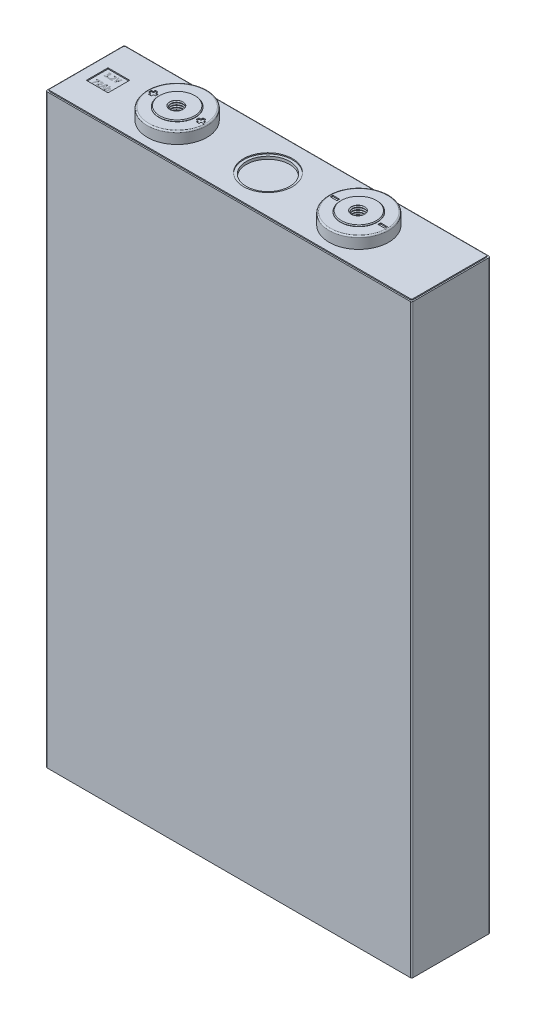
from build123d import *

# Parameters (mm, degrees)
SKETCH1_W           = 135
SKETCH1_H           = 29
BOSS_EXTRUDE1_DEPTH = 216
SKETCH2_W           = 134
SKETCH2_H           = 28
BOSS_EXTRUDE2_DEPTH = 0.4
SKETCH3_R           = 9
CUT_EXTRUDE1_DEPTH  = 0.4
SKETCH4_R           = 8
CUT_EXTRUDE2_DEPTH  = 1
SKETCH6_R           = 11
BOSS_EXTRUDE4_DEPTH = 4.25
SKETCH7_R           = 6.75
BOSS_EXTRUDE5_DEPTH = 0.4
SKETCH8_R           = 2.25
CUT_EXTRUDE3_DEPTH  = 8
THREAD1_PITCH       = 0.8
THREAD2_PITCH       = 0.8
CHAMFER1_SIZE       = 0.3
FILLET1_R           = 0.5
FILLET2_R           = 0.5
FILLET3_R           = 0.5
CUT_EXTRUDE4_DEPTH  = 0.4
CUT_EXTRUDE5_DEPTH  = 0.4
BOSS_EXTRUDE6_DEPTH = 0.01
SCALE2_SCALE        = 0.6


with BuildPart() as part:
    # Sketch1 → Boss-Extrude1 (new body)
    with BuildSketch(Plane(origin=(0, 0, 0), x_dir=(1, 0, 0), z_dir=(0, 1, 0))):
        Rectangle(SKETCH1_W, SKETCH1_H)
    extrude(amount=BOSS_EXTRUDE1_DEPTH)

    # Sketch2 → Boss-Extrude2 (add)
    with BuildSketch(Plane(origin=(0, 0, 0), x_dir=(-1, 0, 0), z_dir=(0, -1, 0))):
        Rectangle(SKETCH2_W, SKETCH2_H)
    boss_extrude2 = extrude(amount=BOSS_EXTRUDE2_DEPTH)

    # Mirror1: Boss-Extrude2 across plane
    add(boss_extrude2.mirror(Plane.ZX.offset(108)))

    # Sketch3 → Cut-Extrude1 (cut)
    with BuildSketch(Plane(origin=(0, 216.4, 0), x_dir=(1, 0, 0), z_dir=(0, 1, 0))):
        with Locations(Location((0, 0, 0), (0, 0, 270))):
            Circle(SKETCH3_R)
    extrude(amount=-CUT_EXTRUDE1_DEPTH, mode=Mode.SUBTRACT)

    # Sketch4 → Cut-Extrude2 (cut)
    with BuildSketch(Plane(origin=(0, 216, 0), x_dir=(1, 0, 0), z_dir=(0, 1, 0))):
        with Locations(Location((0, 0, 0), (0, 0, 270))):
            Circle(SKETCH4_R)
    extrude(amount=-CUT_EXTRUDE2_DEPTH, mode=Mode.SUBTRACT)

    # Sketch6 → Boss-Extrude4 (add)
    with BuildSketch(Plane(origin=(0, 216.4, 0), x_dir=(1, 0, 0), z_dir=(0, 1, 0))):
        with Locations(Location((-33.5, 0, 0), (0, 0, 90))):
            Circle(SKETCH6_R)
        with Locations(Location((33.5, 0, 0), (0, 0, 90))):
            Circle(SKETCH6_R)
    extrude(amount=BOSS_EXTRUDE4_DEPTH)

    # Sketch7 → Boss-Extrude5 (add)
    with BuildSketch(Plane(origin=(0, 220.65, 0), x_dir=(1, 0, 0), z_dir=(0, 1, 0))):
        with Locations(Location((-33.5, 0, 0), (0, 0, 270))):
            Circle(SKETCH7_R)
        with Locations(Location((33.5, 0, 0), (0, 0, 270))):
            Circle(SKETCH7_R)
    extrude(amount=BOSS_EXTRUDE5_DEPTH)

    # Sketch8 → Cut-Extrude3 (cut)
    with BuildSketch(Plane(origin=(0, 221.05, 0), x_dir=(1, 0, 0), z_dir=(0, 1, 0))):
        with Locations(Location((33.5, 0, 0), (0, 0, 270))):
            Circle(SKETCH8_R)
        with Locations(Location((-33.5, 0, 0), (0, 0, 270))):
            Circle(SKETCH8_R)
    extrude(amount=-CUT_EXTRUDE3_DEPTH, mode=Mode.SUBTRACT)

    # Thread1: arcs per turn and ends read off the stored shape
    # Thread1: the profile of Thread Profile1 profile screwed along a right-hand helix through 10 turns, 8 arcs to a turn; built about Z, then put on its axis
    thread1_z = Axis((0, 0, 0), (0, 0, 1))
    thread1_corners = [(2.2497, 0, -0.000173205), (2.6830127, 0, 0.249999999), (2.6830127, 0, 0.349999999), (2.2497, 0, 0.600173203)]
    with BuildLine(mode=Mode.PRIVATE) as thread1_profile:
        Line(thread1_corners[0], thread1_corners[1])
        Line(thread1_corners[1], thread1_corners[2])
        Line(thread1_corners[2], thread1_corners[3])
        Line(thread1_corners[3], thread1_corners[0])
    thread1_cap = Face(thread1_profile.wire())
    thread1_turn_angles = [0, 22.5, 45, 67.5, 90, 112.5, 135, 157.5, 180, 202.5, 225, 247.5, 270, 292.5, 315, 337.5, 360]
    thread1_turn_weights = [1, 0.9238795325112867, 1, 0.9238795325112867, 1, 0.9238795325112867, 1, 0.9238795325112867, 1, 0.9238795325112867, 1, 0.9238795325112867, 1, 0.9238795325112867, 1, 0.9238795325112867, 1]
    thread1_turn_rails = [Edge.make_bspline([Vector(p[0], p[1], 0).rotate(thread1_z, thread1_turn_angles[k]) / thread1_turn_weights[k] + Vector(0, 0, p[2] + THREAD1_PITCH * thread1_turn_angles[k] / 360) for k in range(17)], [0, 0, 0, 1, 1, 2, 2, 3, 3, 4, 4, 5, 5, 6, 6, 7, 7, 8, 8, 8], 2, thread1_turn_weights) for p in thread1_corners]
    thread1_turn_sides = [Face.make_surface_from_curves(thread1_turn_rails[p[0]], thread1_turn_rails[p[1]]) for p in [(0, 1), (1, 2), (2, 3), (3, 0)]]
    thread1 = Plane(origin=(33.5, 213.05, 0), x_dir=(1, 0, 0), z_dir=(0, 1, 0)) * Solid(Shell([*[p.moved(Location((0, 0, THREAD1_PITCH * i))) for i in range(10) for p in thread1_turn_sides], thread1_cap, thread1_cap.rotate(thread1_z, 3600).moved(Location((0, 0, THREAD1_PITCH * 3600 / 360)))]))
    add(thread1, mode=Mode.SUBTRACT)

    # Thread2: arcs per turn and ends read off the stored shape
    # Thread2: the profile of Thread Profile2 profile screwed along a right-hand helix through 10 turns, 8 arcs to a turn; built about Z, then put on its axis
    thread2_z = Axis((0, 0, 0), (0, 0, 1))
    thread2_corners = [(2.2497, 0, -0.000173205), (2.6830127, 0, 0.249999999), (2.6830127, 0, 0.349999999), (2.2497, 0, 0.600173203)]
    with BuildLine(mode=Mode.PRIVATE) as thread2_profile:
        Line(thread2_corners[0], thread2_corners[1])
        Line(thread2_corners[1], thread2_corners[2])
        Line(thread2_corners[2], thread2_corners[3])
        Line(thread2_corners[3], thread2_corners[0])
    thread2_cap = Face(thread2_profile.wire())
    thread2_turn_angles = [0, 22.5, 45, 67.5, 90, 112.5, 135, 157.5, 180, 202.5, 225, 247.5, 270, 292.5, 315, 337.5, 360]
    thread2_turn_weights = [1, 0.9238795325112867, 1, 0.9238795325112867, 1, 0.9238795325112867, 1, 0.9238795325112867, 1, 0.9238795325112867, 1, 0.9238795325112867, 1, 0.9238795325112867, 1, 0.9238795325112867, 1]
    thread2_turn_rails = [Edge.make_bspline([Vector(p[0], p[1], 0).rotate(thread2_z, thread2_turn_angles[k]) / thread2_turn_weights[k] + Vector(0, 0, p[2] + THREAD2_PITCH * thread2_turn_angles[k] / 360) for k in range(17)], [0, 0, 0, 1, 1, 2, 2, 3, 3, 4, 4, 5, 5, 6, 6, 7, 7, 8, 8, 8], 2, thread2_turn_weights) for p in thread2_corners]
    thread2_turn_sides = [Face.make_surface_from_curves(thread2_turn_rails[p[0]], thread2_turn_rails[p[1]]) for p in [(0, 1), (1, 2), (2, 3), (3, 0)]]
    thread2 = Plane(origin=(-33.5, 213.05, 0), x_dir=(1, 0, 0), z_dir=(0, 1, 0)) * Solid(Shell([*[p.moved(Location((0, 0, THREAD2_PITCH * i))) for i in range(10) for p in thread2_turn_sides], thread2_cap, thread2_cap.rotate(thread2_z, 3600).moved(Location((0, 0, THREAD2_PITCH * 3600 / 360)))]))
    add(thread2, mode=Mode.SUBTRACT)

    # Chamfer1
    chamfer1_edges = [part.edges().sort_by_distance(p)[0] for p in [
        (-33.5, 221.05, -6.75),
        (33.5, 221.05, -6.75),
    ]]
    chamfer(chamfer1_edges, length=CHAMFER1_SIZE)

    # Fillet1
    fillet1_edges = [part.edges().sort_by_distance(p)[0] for p in [
        (-33.5, 220.65, 11),
        (33.5, 220.65, 11),
    ]]
    fillet(fillet1_edges, radius=FILLET1_R)

    # Fillet2
    fillet2_edges = [part.edges().sort_by_distance(p)[0] for p in [
        (67.5, 108, 14.5),
        (-67.5, 108, 14.5),
        (-67.5, 108, -14.5),
        (67.5, 108, -14.5),
    ]]
    fillet(fillet2_edges, radius=FILLET2_R)

    # Fillet3
    fillet3_edges = [part.edges().sort_by_distance(p)[0] for p in [
        (67, -0.2, -14),
        (67, -0.2, 14),
        (-67, -0.2, 14),
        (-67, -0.2, -14),
        (67, 216.2, 14),
        (67, 216.2, -14),
        (-67, 216.2, -14),
        (-67, 216.2, 14),
    ]]
    fillet(fillet3_edges, radius=FILLET3_R)

    # Sketch15 → Cut-Extrude4 (cut)
    with BuildSketch(Plane(origin=(0, 220.65, 0), x_dir=(1, 0, 0), z_dir=(0, 1, 0))):
        with BuildLine():
            Line((43.45, 0.5), (41.15, 0.5))
            ThreePointArc((41.15, 0.5), (41.079289322, 0.470710678), (41.05, 0.4))
            Line((41.05, 0.4), (41.05, -0.4))
            ThreePointArc((41.05, -0.4), (41.079289322, -0.470710678), (41.15, -0.5))
            Line((41.15, -0.5), (43.45, -0.5))
            ThreePointArc((43.45, -0.5), (43.520710678, -0.470710678), (43.55, -0.4))
            Line((43.55, -0.4), (43.55, 0.4))
            ThreePointArc((43.55, 0.4), (43.520710678, 0.470710678), (43.45, 0.5))
        make_face()
        with BuildLine():
            Line((25.95, 0.4), (25.95, -0.4))
            ThreePointArc((25.95, -0.4), (25.920710678, -0.470710678), (25.85, -0.5))
            Line((25.85, -0.5), (23.55, -0.5))
            ThreePointArc((23.55, -0.5), (23.479289322, -0.470710678), (23.45, -0.4))
            Line((23.45, -0.4), (23.45, 0.4))
            ThreePointArc((23.45, 0.4), (23.479289322, 0.470710678), (23.55, 0.5))
            Line((23.55, 0.5), (25.85, 0.5))
            ThreePointArc((25.85, 0.5), (25.920710678, 0.470710678), (25.95, 0.4))
        make_face()
        with BuildLine():
            Line((-41.05, 0.4), (-41.05, -0.4))
            ThreePointArc((-41.05, -0.4), (-41.079289322, -0.470710678), (-41.15, -0.5))
            Line((-41.15, -0.5), (-41.7, -0.5))
            ThreePointArc((-41.7, -0.5), (-41.770710678, -0.529289322), (-41.8, -0.6))
            Line((-41.8, -0.6), (-41.8, -1.15))
            ThreePointArc((-41.8, -1.15), (-41.829289322, -1.220710678), (-41.9, -1.25))
            Line((-41.9, -1.25), (-42.7, -1.25))
            ThreePointArc((-42.7, -1.25), (-42.770710678, -1.220710678), (-42.8, -1.15))
            Line((-42.8, -1.15), (-42.8, -0.6))
            ThreePointArc((-42.8, -0.6), (-42.829289322, -0.529289322), (-42.9, -0.5))
            Line((-42.9, -0.5), (-43.45, -0.5))
            ThreePointArc((-43.45, -0.5), (-43.520710678, -0.470710678), (-43.55, -0.4))
            Line((-43.55, -0.4), (-43.55, 0.4))
            ThreePointArc((-43.55, 0.4), (-43.520710678, 0.470710678), (-43.45, 0.5))
            Line((-43.45, 0.5), (-42.9, 0.5))
            ThreePointArc((-42.9, 0.5), (-42.829289322, 0.529289322), (-42.8, 0.6))
            Line((-42.8, 0.6), (-42.8, 1.15))
            ThreePointArc((-42.8, 1.15), (-42.770710678, 1.220710678), (-42.7, 1.25))
            Line((-42.7, 1.25), (-41.9, 1.25))
            ThreePointArc((-41.9, 1.25), (-41.829289322, 1.220710678), (-41.8, 1.15))
            Line((-41.8, 1.15), (-41.8, 0.6))
            ThreePointArc((-41.8, 0.6), (-41.770710678, 0.529289322), (-41.7, 0.5))
            Line((-41.7, 0.5), (-41.15, 0.5))
            ThreePointArc((-41.15, 0.5), (-41.079289322, 0.470710678), (-41.05, 0.4))
        make_face()
        with BuildLine():
            Line((-24.2, 0.6), (-24.2, 1.15))
            ThreePointArc((-24.2, 1.15), (-24.229289322, 1.220710678), (-24.3, 1.25))
            Line((-24.3, 1.25), (-25.1, 1.25))
            ThreePointArc((-25.1, 1.25), (-25.170710678, 1.220710678), (-25.2, 1.15))
            Line((-25.2, 1.15), (-25.2, 0.6))
            ThreePointArc((-25.2, 0.6), (-25.229289322, 0.529289322), (-25.3, 0.5))
            Line((-25.3, 0.5), (-25.85, 0.5))
            ThreePointArc((-25.85, 0.5), (-25.920710678, 0.470710678), (-25.95, 0.4))
            Line((-25.95, 0.4), (-25.95, -0.4))
            ThreePointArc((-25.95, -0.4), (-25.920710678, -0.470710678), (-25.85, -0.5))
            Line((-25.85, -0.5), (-25.3, -0.5))
            ThreePointArc((-25.3, -0.5), (-25.229289322, -0.529289322), (-25.2, -0.6))
            Line((-25.2, -0.6), (-25.2, -1.15))
            ThreePointArc((-25.2, -1.15), (-25.170710678, -1.220710678), (-25.1, -1.25))
            Line((-25.1, -1.25), (-24.3, -1.25))
            ThreePointArc((-24.3, -1.25), (-24.229289322, -1.220710678), (-24.2, -1.15))
            Line((-24.2, -1.15), (-24.2, -0.6))
            ThreePointArc((-24.2, -0.6), (-24.170710678, -0.529289322), (-24.1, -0.5))
            Line((-24.1, -0.5), (-23.55, -0.5))
            ThreePointArc((-23.55, -0.5), (-23.479289322, -0.470710678), (-23.45, -0.4))
            Line((-23.45, -0.4), (-23.45, 0.4))
            ThreePointArc((-23.45, 0.4), (-23.479289322, 0.470710678), (-23.55, 0.5))
            Line((-23.55, 0.5), (-24.1, 0.5))
            ThreePointArc((-24.1, 0.5), (-24.170710678, 0.529289322), (-24.2, 0.6))
        make_face()
    extrude(amount=-CUT_EXTRUDE4_DEPTH, mode=Mode.SUBTRACT)

    # Sketch16 → Cut-Extrude5 (cut)
    with BuildSketch(Plane(origin=(0, 216.4, 0), x_dir=(1, 0, 0), z_dir=(0, 1, 0))):
        with BuildLine():
            Line((-55.2, 4), (-62.8, 4))
            ThreePointArc((-62.8, 4), (-62.941421356, 3.941421356), (-63, 3.8))
            Line((-63, 3.8), (-63, -3.8))
            ThreePointArc((-63, -3.8), (-62.941421356, -3.941421356), (-62.8, -4))
            Line((-62.8, -4), (-55.2, -4))
            ThreePointArc((-55.2, -4), (-55.058578644, -3.941421356), (-55, -3.8))
            Line((-55, -3.8), (-55, 3.8))
            ThreePointArc((-55, 3.8), (-55.058578644, 3.941421356), (-55.2, 4))
        make_face()
    extrude(amount=-CUT_EXTRUDE5_DEPTH, mode=Mode.SUBTRACT)

    # Sketch17 → Boss-Extrude6 (add)
    # profile 1 of 8: a face of its own
    with BuildSketch(Plane(origin=(0, 216, 0), x_dir=(1, 0, 0), z_dir=(0, 1, 0))):
        with BuildLine():
            add(Edge.make_bspline(
                [(-61.013603983, 2.077031829), (-61.00056812, 2.081953142), (-60.97490373, 2.091641991), (-60.938214824, 2.109123778), (-60.903802204, 2.128600297), (-60.87207919, 2.150682551), (-60.842452145, 2.174471652), (-60.815178632, 2.200464926), (-60.790750304, 2.228971866), (-60.768287837, 2.259056894), (-60.749096504, 2.291178313), (-60.731237456, 2.323962662), (-60.717248289, 2.35853496), (-60.704918295, 2.393783875), (-60.696014876, 2.430456669), (-60.689161883, 2.468081769), (-60.684928813, 2.507029093), (-60.684311898, 2.533383233), (-60.683999778, 2.546716781)],
                knots=[0, 0, 0, 0, 1.087849232, 2.141706252, 3.170578034, 4.17264117, 5.156899428, 6.135856436, 7.110126461, 8.085928397, 9.064097591, 10.030173025, 10.998241396, 11.973005849, 12.94440323, 13.941839655, 14.958699474, 16, 16, 16, 16], degree=3))
            add(Edge.make_bspline(
                [(-60.683999778, 2.546716781), (-60.684310647, 2.5633283), (-60.684920423, 2.595912147), (-60.691238243, 2.643713942), (-60.701005465, 2.689505758), (-60.714378553, 2.733334799), (-60.732358048, 2.774854722), (-60.754378434, 2.814155321), (-60.78005621, 2.851574359), (-60.809468143, 2.886804111), (-60.842963888, 2.919037131), (-60.88097963, 2.946934391), (-60.92289073, 2.971056862), (-60.96914625, 2.990317752), (-61.019015307, 3.006421342), (-61.073166605, 3.017387831), (-61.1311244, 3.025132182), (-61.171278646, 3.026686881), (-61.19191833, 3.027486012)],
                knots=[0, 0, 0, 0, 1.009492297, 1.980140478, 2.925951987, 3.854155462, 4.7612932, 5.671323502, 6.589181822, 7.51678736, 8.457304499, 9.408012391, 10.37676339, 11.390268556, 12.44887027, 13.55801485, 14.744795279, 16, 16, 16, 16], degree=3))
            add(Edge.make_bspline(
                [(-61.19191833, 3.027486012), (-61.215445905, 3.026713624), (-61.261637756, 3.02519719), (-61.329515017, 3.016822513), (-61.394400381, 3.003192755), (-61.455850602, 2.985199884), (-61.512708907, 2.963864924), (-61.563954388, 2.940535088), (-61.609612937, 2.916030065), (-61.63617765, 2.896561682), (-61.648931904, 2.887214519)],
                knots=[0, 0, 0, 0, 1.163088269, 2.283499147, 3.375209201, 4.436807197, 5.445325293, 6.373885885, 7.219269795, 8, 8, 8, 8], degree=3))
            Line((-61.648931904, 2.887214519), (-61.578595837, 2.665943942))
            add(Edge.make_bspline(
                [(-61.578595837, 2.665943942), (-61.569105312, 2.673380057), (-61.549288106, 2.68890744), (-61.51592714, 2.709648715), (-61.478838073, 2.730130533), (-61.438237612, 2.749396149), (-61.395154444, 2.767151522), (-61.349598228, 2.779156051), (-61.302861114, 2.788093605), (-61.271021124, 2.789562382), (-61.254889672, 2.790306525)],
                knots=[0, 0, 0, 0, 0.819906271, 1.71204973, 2.669072813, 3.702008935, 4.769323524, 5.833789877, 6.902508625, 8, 8, 8, 8], degree=3))
            add(Edge.make_bspline(
                [(-61.254889672, 2.790306525), (-61.24318632, 2.789877543), (-61.220446955, 2.789044042), (-61.187606678, 2.784546114), (-61.157117574, 2.777245261), (-61.128910096, 2.76796041), (-61.102762417, 2.756317746), (-61.079412722, 2.741400442), (-61.058094824, 2.724394064), (-61.033015887, 2.698659126), (-61.006972067, 2.661712032), (-60.985082101, 2.611386632), (-60.971401093, 2.555859345), (-60.970111085, 2.517010552), (-60.969444725, 2.496943025)],
                knots=[0, 0, 0, 0, 0.910591609, 1.769260246, 2.573192408, 3.346146932, 4.076824078, 4.792965506, 5.495359622, 6.193658906, 7.582570221, 8.983303729, 10.441711409, 12, 12, 12, 12], degree=3))
            add(Edge.make_bspline(
                [(-60.969444725, 2.496943025), (-60.970480828, 2.483094809), (-60.972497758, 2.456137169), (-60.979130455, 2.41701125), (-60.98979171, 2.380812615), (-61.003364122, 2.347225203), (-61.020305133, 2.316457035), (-61.040985592, 2.288823367), (-61.064484164, 2.263422352), (-61.100433703, 2.234819349), (-61.147788782, 2.204295585), (-61.208104077, 2.178793471), (-61.269523946, 2.16158861), (-61.311338017, 2.159917936), (-61.332189823, 2.159084805)],
                knots=[0, 0, 0, 0, 0.906432025, 1.764506532, 2.585151528, 3.365411883, 4.125827045, 4.870988969, 5.614114619, 6.37802007, 7.864679127, 9.276283941, 10.641739562, 12, 12, 12, 12], degree=3))
            Line((-61.332189823, 2.159084805), (-61.450430847, 2.159461511))
            Line((-61.450430847, 2.159461511), (-61.450430847, 1.969416262))
            Line((-61.450430847, 1.969416262), (-61.327102271, 1.969416262))
            add(Edge.make_bspline(
                [(-61.327102271, 1.969416262), (-61.313831508, 1.969094908), (-61.287541093, 1.96845828), (-61.248743425, 1.964351656), (-61.211316736, 1.957140776), (-61.175300952, 1.947216904), (-61.140383618, 1.935029374), (-61.107190807, 1.91883414), (-61.075093153, 1.900445587), (-61.044504121, 1.879378046), (-61.016006818, 1.855533707), (-60.991521971, 1.827779325), (-60.970495759, 1.797077609), (-60.952710542, 1.763503969), (-60.938741682, 1.726631524), (-60.928687246, 1.686629627), (-60.921861138, 1.64371042), (-60.920163795, 1.613986629), (-60.919293895, 1.59875298)],
                knots=[0, 0, 0, 0, 1.027981758, 2.036511983, 3.017985651, 3.976938623, 4.928548511, 5.877914445, 6.833153314, 7.791908564, 8.751849537, 9.703509231, 10.648722341, 11.628649467, 12.639432974, 13.694990485, 14.818666652, 16, 16, 16, 16], degree=3))
            add(Edge.make_bspline(
                [(-60.919293895, 1.59875298), (-60.919489826, 1.587432654), (-60.919876297, 1.565103409), (-60.923586613, 1.532115097), (-60.930662986, 1.500314955), (-60.939538938, 1.469160804), (-60.951596407, 1.438925084), (-60.967001336, 1.409939039), (-60.984184902, 1.381400612), (-61.004594217, 1.354340803), (-61.027683789, 1.328841298), (-61.054901731, 1.306858387), (-61.085240266, 1.28803784), (-61.118669018, 1.271991051), (-61.155585918, 1.259698173), (-61.195731416, 1.250372311), (-61.23910773, 1.243824513), (-61.269194714, 1.242398081), (-61.284678511, 1.241663991)],
                knots=[0, 0, 0, 0, 0.94443027, 1.862880478, 2.763858981, 3.659940825, 4.563601181, 5.473629477, 6.396381024, 7.340287047, 8.297672753, 9.259185635, 10.248606925, 11.271265901, 12.345847829, 13.488060308, 14.707269436, 16, 16, 16, 16], degree=3))
            add(Edge.make_bspline(
                [(-61.284678511, 1.241663991), (-61.303432641, 1.242481587), (-61.340327825, 1.244090051), (-61.394543612, 1.251868568), (-61.446678318, 1.26339798), (-61.495823167, 1.279196789), (-61.540726079, 1.297303466), (-61.580832884, 1.315097011), (-61.615238618, 1.333493754), (-61.635333871, 1.347206317), (-61.644784091, 1.353654941)],
                knots=[0, 0, 0, 0, 1.178144381, 2.317774834, 3.434099985, 4.527392277, 5.554798561, 6.473196211, 7.28198805, 8, 8, 8, 8], degree=3))
            Line((-61.644784091, 1.353654941), (-61.717302326, 1.124541669))
            add(Edge.make_bspline(
                [(-61.717302326, 1.124541669), (-61.705223966, 1.116561775), (-61.679766494, 1.099742613), (-61.636337983, 1.078731846), (-61.587095175, 1.058723677), (-61.532140289, 1.040391678), (-61.472333699, 1.02503804), (-61.408678541, 1.013820654), (-61.341779748, 1.006525787), (-61.296009649, 1.005175014), (-61.272612146, 1.004484504)],
                knots=[0, 0, 0, 0, 0.743623742, 1.567330306, 2.474617882, 3.476020562, 4.543458937, 5.646364127, 6.796830128, 8, 8, 8, 8], degree=3))
            add(Edge.make_bspline(
                [(-61.272612146, 1.004484504), (-61.247445891, 1.005482458), (-61.198591986, 1.007419735), (-61.127726846, 1.016597156), (-61.061495091, 1.030456126), (-60.999697641, 1.04904241), (-60.942894906, 1.073484259), (-60.890300003, 1.102078376), (-60.84255107, 1.136132839), (-60.79997523, 1.175287593), (-60.76193134, 1.217717393), (-60.728934792, 1.263278642), (-60.700964593, 1.31131362), (-60.677799877, 1.361803803), (-60.659527388, 1.414813016), (-60.64692885, 1.470585504), (-60.638674178, 1.528748539), (-60.637724544, 1.568432661), (-60.637242613, 1.588571985)],
                knots=[0, 0, 0, 0, 1.245025493, 2.416901409, 3.528701332, 4.588461069, 5.602140261, 6.581389535, 7.543845203, 8.494222486, 9.436270128, 10.357562582, 11.271190801, 12.180686612, 13.100615135, 14.038449618, 15.004531348, 16, 16, 16, 16], degree=3))
            add(Edge.make_bspline(
                [(-60.637242613, 1.588571985), (-60.637845285, 1.605561683), (-60.639018631, 1.638639011), (-60.645370939, 1.686863026), (-60.654086197, 1.732470436), (-60.666699613, 1.775473295), (-60.682394834, 1.815775763), (-60.701540226, 1.853395173), (-60.723157926, 1.888706919), (-60.748754678, 1.920586255), (-60.776137352, 1.950076006), (-60.805598839, 1.976350683), (-60.836416648, 2.000010201), (-60.868693179, 2.02086015), (-60.902984725, 2.038082771), (-60.938371709, 2.053045752), (-60.975602358, 2.064296357), (-61.001075446, 2.06965279), (-61.013939446, 2.072357807)],
                knots=[0, 0, 0, 0, 1.219516455, 2.374282691, 3.487129474, 4.549121199, 5.586104044, 6.586659268, 7.575432254, 8.551822572, 9.515586712, 10.461064034, 11.381284519, 12.302212253, 13.214036836, 14.132132301, 15.056720213, 16, 16, 16, 16], degree=3))
            Line((-61.013939446, 2.072357807), (-61.013603983, 2.077031829))
        make_face()
    # profile 2 of 8: a face of its own
    with BuildSketch(Plane(origin=(0, 216, 0), x_dir=(1, 0, 0), z_dir=(0, 1, 0))):
        with BuildLine():
            add(Edge.make_bspline(
                [(-60.067546541, 1.00410743), (-60.054232734, 1.004921266), (-60.028653092, 1.006484879), (-59.992779762, 1.017985677), (-59.960845679, 1.03526023), (-59.934902672, 1.060566928), (-59.913418369, 1.090443072), (-59.898499192, 1.125498375), (-59.888736186, 1.164470055), (-59.887504762, 1.1919529), (-59.886865539, 1.206219044)],
                knots=[0, 0, 0, 0, 1.048761853, 2.014972424, 2.947506715, 3.887710263, 4.848151142, 5.834065356, 6.875679208, 8, 8, 8, 8], degree=3))
            add(Edge.make_bspline(
                [(-59.886865539, 1.206219044), (-59.887661609, 1.220856923), (-59.889189015, 1.24894239), (-59.898777498, 1.288717033), (-59.913825322, 1.324206772), (-59.935121094, 1.354530738), (-59.961240794, 1.379499519), (-59.992219564, 1.397581613), (-60.027390498, 1.408887878), (-60.05231415, 1.41050815), (-60.065221497, 1.411347249)],
                knots=[0, 0, 0, 0, 1.154139336, 2.214428825, 3.208866975, 4.176867481, 5.116538148, 6.036286074, 6.983040833, 8, 8, 8, 8], degree=3))
            add(Edge.make_bspline(
                [(-60.065221497, 1.411347249), (-60.077999691, 1.410349886), (-60.10265736, 1.408425306), (-60.137765783, 1.397131855), (-60.168849592, 1.378614506), (-60.195715652, 1.353456225), (-60.217496062, 1.322881326), (-60.23364817, 1.287741288), (-60.243551469, 1.248349805), (-60.245058407, 1.220606563), (-60.245839898, 1.206219044)],
                knots=[0, 0, 0, 0, 1.007186512, 1.943535404, 2.875896242, 3.835825584, 4.822354709, 5.814829819, 6.866780636, 8, 8, 8, 8], degree=3))
            add(Edge.make_bspline(
                [(-60.245839898, 1.206219044), (-60.245318087, 1.192335023), (-60.244309716, 1.165504938), (-60.23492418, 1.127275566), (-60.220233917, 1.092603847), (-60.19937358, 1.062458733), (-60.173684314, 1.036875558), (-60.142361344, 1.018670737), (-60.106625787, 1.006842963), (-60.081156485, 1.005045658), (-60.067546541, 1.00410743)],
                knots=[0, 0, 0, 0, 1.103363721, 2.132188027, 3.113462727, 4.084690681, 5.032713221, 5.9746459, 6.942725787, 8, 8, 8, 8], degree=3))
        make_face()
    # profile 3 of 8: a face of its own
    with BuildSketch(Plane(origin=(0, 216, 0), x_dir=(1, 0, 0), z_dir=(0, 1, 0))):
        with BuildLine():
            Line((-58.523135777, 1.265985626), (-59.257392574, 1.265985626))
            Line((-59.257392574, 1.265985626), (-59.257392574, 1.271288228))
            Line((-59.257392574, 1.271288228), (-59.107463717, 1.438320185))
            add(Edge.make_bspline(
                [(-59.107463717, 1.438320185), (-59.087749488, 1.459653662), (-59.048750701, 1.501855654), (-58.992715358, 1.566051428), (-58.939055555, 1.629502168), (-58.888897028, 1.69308689), (-58.841524335, 1.756051338), (-58.796227619, 1.818083432), (-58.755150033, 1.880528551), (-58.715787444, 1.941848172), (-58.680623124, 2.003624005), (-58.649929478, 2.066215836), (-58.623352727, 2.129426814), (-58.601913972, 2.193764703), (-58.584780001, 2.258868721), (-58.572477758, 2.324782752), (-58.564224569, 2.39154064), (-58.562629694, 2.436336412), (-58.561827832, 2.458858561)],
                knots=[0, 0, 0, 0, 1.176823359, 2.327997867, 3.452091242, 4.543265972, 5.608610135, 6.644594476, 7.654453684, 8.636358694, 9.596457045, 10.532498005, 11.459323245, 12.372406122, 13.277788094, 14.184672586, 15.087300625, 16, 16, 16, 16], degree=3))
            add(Edge.make_bspline(
                [(-58.561827832, 2.458858561), (-58.562194866, 2.477974671), (-58.562916111, 2.515538982), (-58.568467029, 2.570959234), (-58.578865711, 2.624084118), (-58.592520263, 2.675357214), (-58.611336901, 2.723999123), (-58.633391689, 2.770838057), (-58.660642517, 2.814884478), (-58.690706384, 2.857287763), (-58.725806822, 2.896039559), (-58.766132473, 2.929721717), (-58.810990504, 2.95855515), (-58.860396709, 2.982391485), (-58.914473043, 3.001160326), (-58.973011266, 3.015509605), (-59.036427552, 3.024537749), (-59.080275207, 3.026481686), (-59.102928888, 3.027486012)],
                knots=[0, 0, 0, 0, 1.034428947, 2.032715376, 3.00919061, 3.961293293, 4.8998889, 5.827776612, 6.758651095, 7.698798081, 8.637664749, 9.579090311, 10.533764872, 11.516356493, 12.540334238, 13.625830129, 14.773396548, 16, 16, 16, 16], degree=3))
            add(Edge.make_bspline(
                [(-59.102928888, 3.027486012), (-59.127971835, 3.026514786), (-59.17711118, 3.024609043), (-59.249108742, 3.014784573), (-59.31770081, 2.998630138), (-59.382258041, 2.976076787), (-59.44281614, 2.950148797), (-59.498009616, 2.919803281), (-59.549006275, 2.888071745), (-59.579166489, 2.863165218), (-59.593879114, 2.851015424)],
                knots=[0, 0, 0, 0, 1.12969373, 2.216688388, 3.271186884, 4.301880125, 5.296984252, 6.237922523, 7.140430975, 8, 8, 8, 8], degree=3))
            Line((-59.593879114, 2.851015424), (-59.50888614, 2.634056893))
            add(Edge.make_bspline(
                [(-59.50888614, 2.634056893), (-59.497902883, 2.643720719), (-59.475361292, 2.663554362), (-59.437978889, 2.690183695), (-59.397673656, 2.716141431), (-59.354582506, 2.740376638), (-59.308837006, 2.76197896), (-59.260377076, 2.777202911), (-59.210053841, 2.787471485), (-59.175753859, 2.78935255), (-59.158358752, 2.790306525)],
                knots=[0, 0, 0, 0, 0.895425998, 1.837735889, 2.807167033, 3.830739954, 4.864078832, 5.898707146, 6.934337244, 8, 8, 8, 8], degree=3))
            add(Edge.make_bspline(
                [(-59.158358752, 2.790306525), (-59.144629723, 2.789716234), (-59.118047142, 2.788573295), (-59.079891334, 2.782180849), (-59.044593159, 2.773939874), (-59.012445657, 2.761658807), (-58.983479496, 2.746263989), (-58.957285323, 2.727875965), (-58.934174731, 2.706414499), (-58.914598843, 2.681574273), (-58.897849077, 2.654615174), (-58.882563938, 2.626453282), (-58.870154333, 2.596607861), (-58.860481955, 2.565348614), (-58.85231315, 2.532937849), (-58.847261024, 2.498837172), (-58.844127635, 2.463444481), (-58.843962724, 2.439383421), (-58.843879114, 2.427184353)],
                knots=[0, 0, 0, 0, 1.208537195, 2.340008002, 3.400027432, 4.394620619, 5.359853544, 6.280819844, 7.204573538, 8.125606303, 9.055699817, 9.996199655, 10.943508923, 11.895330749, 12.87485394, 13.882653515, 14.9264956, 16, 16, 16, 16], degree=3))
            add(Edge.make_bspline(
                [(-58.843879114, 2.427184353), (-58.844421973, 2.408809019), (-58.845515813, 2.371783465), (-58.853407705, 2.316023881), (-58.866001693, 2.260035375), (-58.882587128, 2.203189611), (-58.904590672, 2.146220142), (-58.931167875, 2.088539538), (-58.962544924, 2.030570605), (-58.998719093, 1.971863518), (-59.039562331, 1.911690142), (-59.084244332, 1.848894998), (-59.133448239, 1.783645589), (-59.186653115, 1.715784281), (-59.244001898, 1.645175271), (-59.305798832, 1.572197452), (-59.371989185, 1.49658167), (-59.417965342, 1.44572265), (-59.441541256, 1.419642875)],
                knots=[0, 0, 0, 0, 0.737406286, 1.48584379, 2.255754092, 3.039539243, 3.860298802, 4.704537823, 5.587112735, 6.504264315, 7.471129341, 8.505648139, 9.597372065, 10.750897911, 11.966642982, 13.248214801, 14.588924086, 16, 16, 16, 16], degree=3))
            Line((-59.441541256, 1.419642875), (-59.632214716, 1.204210683))
            Line((-59.632214716, 1.204210683), (-59.632214716, 1.028805402))
            Line((-59.632214716, 1.028805402), (-58.523135777, 1.028805402))
            Line((-58.523135777, 1.028805402), (-58.523135777, 1.265985626))
        make_face()
    # profile 4 of 8: a face of its own
    with BuildSketch(Plane(origin=(0, 216, 0), x_dir=(1, 0, 0), z_dir=(0, 1, 0))):
        with BuildLine():
            Line((-57.121115707, 3.028239791), (-57.381645791, 2.081008412))
            add(Edge.make_bspline(
                [(-57.381645791, 2.081008412), (-57.399397755, 2.018377496), (-57.434582931, 1.894240265), (-57.481712001, 1.707910898), (-57.523638149, 1.523169264), (-57.548145053, 1.400091396), (-57.560319536, 1.338949059)],
                knots=[0, 0, 0, 0, 1.023064056, 2.027757954, 3.020234189, 4, 4, 4, 4], degree=3))
            Line((-57.560319536, 1.338949059), (-57.567394091, 1.338949059))
            add(Edge.make_bspline(
                [(-57.567394091, 1.338949059), (-57.579615204, 1.399837348), (-57.604258435, 1.522615378), (-57.64620512, 1.707411761), (-57.690970031, 1.894904572), (-57.724438698, 2.020142637), (-57.741315011, 2.08329295)],
                knots=[0, 0, 0, 0, 0.974698157, 1.965427504, 2.974082756, 4, 4, 4, 4], degree=3))
            Line((-57.741315011, 2.08329295), (-57.984724687, 3.028239791))
            Line((-57.984724687, 3.028239791), (-58.291088767, 3.028239791))
            Line((-58.291088767, 3.028239791), (-57.731431551, 1.028239791))
            Line((-57.731431551, 1.028239791), (-57.42024284, 1.028239791))
            Line((-57.42024284, 1.028239791), (-56.822008091, 3.028239791))
            Line((-56.822008091, 3.028239791), (-57.121115707, 3.028239791))
        make_face()
    # profile 5 of 8: a face of its own
    with BuildSketch(Plane(origin=(0, 216, 0), x_dir=(1, 0, 0), z_dir=(0, 1, 0))):
        Polygon((-61.667408526, -1.515690055), (-60.853158667, -1.515690055), (-60.853158667, -1.520814062), (-61.577744107, -3.229678761), (-61.289363948, -3.229678761), (-60.564843687, -1.458868626), (-60.564843687, -1.278509831), (-61.667408526, -1.278509831), align=None)
    # profile 6 of 8: a face of its own
    with BuildSketch(Plane(origin=(0, 216, 0), x_dir=(1, 0, 0), z_dir=(0, 1, 0))):
        with BuildLine():
            Line((-59.174719488, -2.991932926), (-59.908976284, -2.991932926))
            Line((-59.908976284, -2.991932926), (-59.908976284, -2.986630324))
            Line((-59.908976284, -2.986630324), (-59.759047427, -2.819598367))
            add(Edge.make_bspline(
                [(-59.759047427, -2.819598367), (-59.739333198, -2.79826489), (-59.700334411, -2.756062898), (-59.644299068, -2.691867124), (-59.590639265, -2.628416384), (-59.540480739, -2.564831662), (-59.493108045, -2.501867215), (-59.447811329, -2.43983512), (-59.406733743, -2.377390001), (-59.367371155, -2.31607038), (-59.332206835, -2.254294547), (-59.301513188, -2.191702716), (-59.274936438, -2.128491738), (-59.253497682, -2.064153849), (-59.236363712, -1.999049831), (-59.224061468, -1.9331358), (-59.21580828, -1.866377912), (-59.214213404, -1.82158214), (-59.213411542, -1.799059991)],
                knots=[0, 0, 0, 0, 1.176823359, 2.327997867, 3.452091242, 4.543265972, 5.608610135, 6.644594476, 7.654453684, 8.636358694, 9.596457045, 10.532498005, 11.459323245, 12.372406122, 13.277788094, 14.184672586, 15.087300625, 16, 16, 16, 16], degree=3))
            add(Edge.make_bspline(
                [(-59.213411542, -1.799059991), (-59.213778577, -1.779943881), (-59.214499822, -1.74237957), (-59.22005074, -1.686959318), (-59.230449421, -1.633834434), (-59.244103973, -1.582561338), (-59.262920612, -1.533919429), (-59.284975399, -1.487080495), (-59.312226227, -1.443034074), (-59.342290094, -1.400630789), (-59.377390532, -1.361878993), (-59.417716183, -1.328196835), (-59.462574215, -1.299363402), (-59.511980419, -1.275527067), (-59.566056753, -1.256758226), (-59.624594976, -1.242408947), (-59.688011263, -1.233380803), (-59.731858918, -1.231436866), (-59.754512598, -1.23043254)],
                knots=[0, 0, 0, 0, 1.034428947, 2.032715376, 3.00919061, 3.961293293, 4.8998889, 5.827776612, 6.758651095, 7.698798081, 8.637664749, 9.579090311, 10.533764872, 11.516356493, 12.540334238, 13.625830129, 14.773396548, 16, 16, 16, 16], degree=3))
            add(Edge.make_bspline(
                [(-59.754512598, -1.23043254), (-59.779555545, -1.231403766), (-59.828694891, -1.233309509), (-59.900692453, -1.243133979), (-59.969284521, -1.259288414), (-60.033841752, -1.281841765), (-60.094399851, -1.307769755), (-60.149593327, -1.338115271), (-60.200589985, -1.369846807), (-60.230750199, -1.394753334), (-60.245462824, -1.406903128)],
                knots=[0, 0, 0, 0, 1.12969373, 2.216688388, 3.271186884, 4.301880125, 5.296984252, 6.237922523, 7.140430975, 8, 8, 8, 8], degree=3))
            Line((-60.245462824, -1.406903128), (-60.16046985, -1.623861659))
            add(Edge.make_bspline(
                [(-60.16046985, -1.623861659), (-60.149486593, -1.614197833), (-60.126945003, -1.59436419), (-60.089562599, -1.567734857), (-60.049257367, -1.541777121), (-60.006166216, -1.517541914), (-59.960420717, -1.495939592), (-59.911960786, -1.480715641), (-59.861637551, -1.470447067), (-59.827337569, -1.468566002), (-59.809942462, -1.467612027)],
                knots=[0, 0, 0, 0, 0.895425998, 1.837735889, 2.807167033, 3.830739954, 4.864078832, 5.898707146, 6.934337244, 8, 8, 8, 8], degree=3))
            add(Edge.make_bspline(
                [(-59.809942462, -1.467612027), (-59.796213433, -1.468202318), (-59.769630853, -1.469345257), (-59.731475045, -1.475737703), (-59.69617687, -1.483978678), (-59.664029368, -1.496259745), (-59.635063206, -1.511654563), (-59.608869033, -1.530042587), (-59.585758442, -1.551504053), (-59.566182554, -1.576344279), (-59.549432788, -1.603303378), (-59.534147649, -1.63146527), (-59.521738044, -1.661310691), (-59.512065665, -1.692569938), (-59.50389686, -1.724980703), (-59.498844734, -1.75908138), (-59.495711346, -1.794474071), (-59.495546435, -1.818535131), (-59.495462824, -1.830734199)],
                knots=[0, 0, 0, 0, 1.208537195, 2.340008002, 3.400027432, 4.394620619, 5.359853544, 6.280819844, 7.204573538, 8.125606303, 9.055699817, 9.996199655, 10.943508923, 11.895330749, 12.87485394, 13.882653515, 14.9264956, 16, 16, 16, 16], degree=3))
            add(Edge.make_bspline(
                [(-59.495462824, -1.830734199), (-59.496005684, -1.849109533), (-59.497099524, -1.886135087), (-59.504991416, -1.941894671), (-59.517585403, -1.997883177), (-59.534170838, -2.054728941), (-59.556174383, -2.11169841), (-59.582751586, -2.169379014), (-59.614128635, -2.227347947), (-59.650302803, -2.286055034), (-59.691146042, -2.34622841), (-59.735828042, -2.409023554), (-59.78503195, -2.474272963), (-59.838236825, -2.542134271), (-59.895585608, -2.612743281), (-59.957382543, -2.6857211), (-60.023572895, -2.761336882), (-60.069549053, -2.812195902), (-60.093124966, -2.838275677)],
                knots=[0, 0, 0, 0, 0.737406286, 1.48584379, 2.255754092, 3.039539243, 3.860298802, 4.704537823, 5.587112735, 6.504264315, 7.471129341, 8.505648139, 9.597372065, 10.750897911, 11.966642982, 13.248214801, 14.588924086, 16, 16, 16, 16], degree=3))
            Line((-60.093124966, -2.838275677), (-60.283798426, -3.053707869))
            Line((-60.283798426, -3.053707869), (-60.283798426, -3.22911315))
            Line((-60.283798426, -3.22911315), (-59.174719488, -3.22911315))
            Line((-59.174719488, -3.22911315), (-59.174719488, -2.991932926))
        make_face()
    # profile 7 of 8: a face of its own
    with BuildSketch(Plane(origin=(0, 216, 0), x_dir=(1, 0, 0), z_dir=(0, 1, 0))):
        Polygon((-57.988899382, -1.229678761), (-58.33087301, -1.229678761), (-58.894407017, -3.229678761), (-58.607823484, -3.229678761), (-58.448877994, -2.649927998), (-57.885343987, -2.649927998), (-57.719173703, -3.229678761), (-57.425326341, -3.229678761), align=None)
        with BuildLine():
            Line((-58.405529225, -2.412747774), (-58.25862506, -1.885461469))
            add(Edge.make_bspline(
                [(-58.25862506, -1.885461469), (-58.250810806, -1.853303536), (-58.234887021, -1.787772523), (-58.213846237, -1.688213218), (-58.19256575, -1.589052955), (-58.17870383, -1.523422705), (-58.171933413, -1.491367683)],
                knots=[0, 0, 0, 0, 0.984056079, 2.005296554, 3.025750136, 4, 4, 4, 4], degree=3))
            Line((-58.171933413, -1.491367683), (-58.167110991, -1.491219652))
            add(Edge.make_bspline(
                [(-58.167110991, -1.491219652), (-58.160347619, -1.523079811), (-58.146498224, -1.588320041), (-58.124498877, -1.687201076), (-58.101017528, -1.787547715), (-58.084169588, -1.854387266), (-58.075779566, -1.887672359)],
                knots=[0, 0, 0, 0, 0.960603885, 1.967034102, 2.987613495, 4, 4, 4, 4], degree=3))
            Line((-58.075779566, -1.887672359), (-57.931101022, -2.412747774))
            Line((-57.931101022, -2.412747774), (-58.405529225, -2.412747774))
        make_face(mode=Mode.SUBTRACT)
    # profile 8 of 8: a face of its own
    with BuildSketch(Plane(origin=(0, 216, 0), x_dir=(1, 0, 0), z_dir=(0, 1, 0))):
        with BuildLine():
            add(Edge.make_bspline(
                [(-56.027890444, -2.351700466), (-56.028977159, -2.324960028), (-56.031070112, -2.2734594), (-56.038848087, -2.199409889), (-56.050890047, -2.131627059), (-56.066450776, -2.070127778), (-56.085969614, -2.014792406), (-56.109818648, -1.965879212), (-56.137077399, -1.922811123), (-56.168916093, -1.886656451), (-56.203099472, -1.856541276), (-56.23748498, -1.829673809), (-56.272937274, -1.807340091), (-56.309388701, -1.789509779), (-56.346531645, -1.7758255), (-56.384419971, -1.766262243), (-56.42317608, -1.761240838), (-56.449195503, -1.761315203), (-56.462280321, -1.761352601)],
                knots=[0, 0, 0, 0, 1.557799958, 3.000237915, 4.330835625, 5.562546538, 6.689749773, 7.740262949, 8.724676992, 9.647784292, 10.533805883, 11.373916916, 12.186027142, 12.968178156, 13.732147193, 14.486417441, 15.238839682, 16, 16, 16, 16], degree=3))
            add(Edge.make_bspline(
                [(-56.462280321, -1.761352601), (-56.480559102, -1.761968436), (-56.517171577, -1.763201957), (-56.571198456, -1.774372552), (-56.624137245, -1.791377348), (-56.675423248, -1.815106768), (-56.723973211, -1.845618206), (-56.768964997, -1.882578902), (-56.809731618, -1.926102721), (-56.8323656, -1.959364856), (-56.843879114, -1.976284727)],
                knots=[0, 0, 0, 0, 0.959123498, 1.921128308, 2.885689571, 3.875210025, 4.880830889, 5.889286657, 6.926316714, 8, 8, 8, 8], degree=3))
            Line((-56.843879114, -1.976284727), (-56.848403633, -1.976109815))
            Line((-56.848403633, -1.976109815), (-56.848403633, -1.138240179))
            Line((-56.848403633, -1.138240179), (-57.130455283, -1.138240179))
            Line((-57.130455283, -1.138240179), (-57.130455283, -3.229678761))
            Line((-57.130455283, -3.229678761), (-56.848403633, -3.229678761))
            Line((-56.848403633, -3.229678761), (-56.848403633, -2.34115418))
            add(Edge.make_bspline(
                [(-56.848403633, -2.34115418), (-56.847693736, -2.327863154), (-56.846307632, -2.30191184), (-56.841431785, -2.264125837), (-56.834043685, -2.228631401), (-56.82369131, -2.195654738), (-56.811447921, -2.164940284), (-56.79620233, -2.136765979), (-56.77837601, -2.111081499), (-56.75846686, -2.087643651), (-56.736560537, -2.067147782), (-56.714092663, -2.04895913), (-56.69066056, -2.03366764), (-56.666768193, -2.020859766), (-56.642020763, -2.010811424), (-56.616488634, -2.004280064), (-56.590422057, -1.999327897), (-56.572661321, -1.998798703), (-56.563713201, -1.998532088)],
                knots=[0, 0, 0, 0, 1.290617275, 2.519987072, 3.691603298, 4.802132877, 5.868419923, 6.89392385, 7.901665308, 8.896044842, 9.870495515, 10.807230175, 11.696513287, 12.580011701, 13.433476801, 14.27924499, 15.133058302, 16, 16, 16, 16], degree=3))
            add(Edge.make_bspline(
                [(-56.563713201, -1.998532088), (-56.552501608, -1.999157806), (-56.530674544, -2.000375972), (-56.499333775, -2.006352027), (-56.470682102, -2.016002231), (-56.444332417, -2.028281461), (-56.420830322, -2.044499317), (-56.399364278, -2.063262737), (-56.38116958, -2.086068937), (-56.359998025, -2.120789406), (-56.339162448, -2.169903289), (-56.321306189, -2.234543684), (-56.311312828, -2.305658763), (-56.310410114, -2.355213244), (-56.309942462, -2.380885029)],
                knots=[0, 0, 0, 0, 0.780934551, 1.52034672, 2.211899745, 2.880957194, 3.536029862, 4.192735839, 4.85806592, 5.557212006, 7.018285331, 8.552722907, 10.214132096, 12, 12, 12, 12], degree=3))
            Line((-56.309942462, -2.380885029), (-56.309942094, -3.229678761))
            Line((-56.309942094, -3.229678761), (-56.027890444, -3.229678761))
            Line((-56.027890444, -3.229678761), (-56.027890444, -2.351700466))
        make_face()
    extrude(amount=BOSS_EXTRUDE6_DEPTH)


with BuildPart() as part_1:
    # Scale2: scaled about (0.001947404, 108.353270802, 3.312e-06)
    add(part.part.scale(SCALE2_SCALE).moved(Location((0.000778962, 43.341308321, 1.325e-06))))


solid = part_1.part
